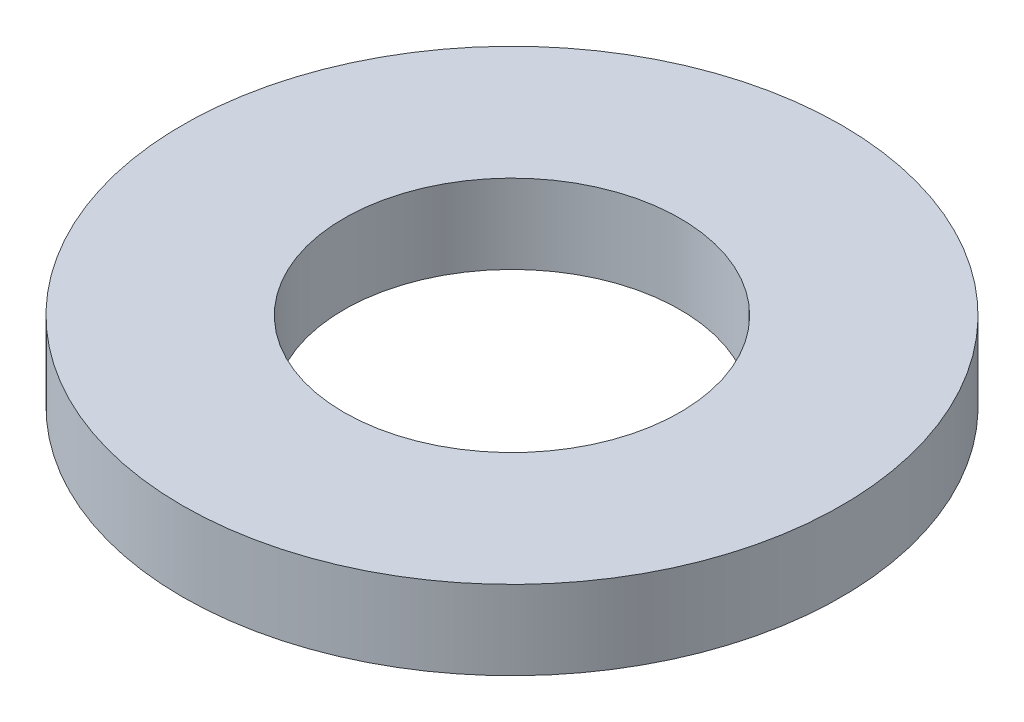
from build123d import *

# Parameters (mm, degrees)
SKETCH1_R           = 5
BOSS_EXTRUDE1_DEPTH = 1.2
SKETCH2_R           = 2.55
CUT_EXTRUDE1_DEPTH  = 1.2


with BuildPart() as part:
    # Sketch1 → Boss-Extrude1 (new body)
    with BuildSketch(Plane(origin=(0, 0, 0), x_dir=(1, 0, 0), z_dir=(0, 1, 0))):
        Circle(SKETCH1_R)
    extrude(amount=BOSS_EXTRUDE1_DEPTH)

    # Sketch2 → Cut-Extrude1 (cut)
    with BuildSketch(Plane(origin=(0, 1.2, 0), x_dir=(1, 0, 0), z_dir=(0, 1, 0))):
        Circle(SKETCH2_R)
    extrude(amount=-CUT_EXTRUDE1_DEPTH, mode=Mode.SUBTRACT)


solid = part.part
